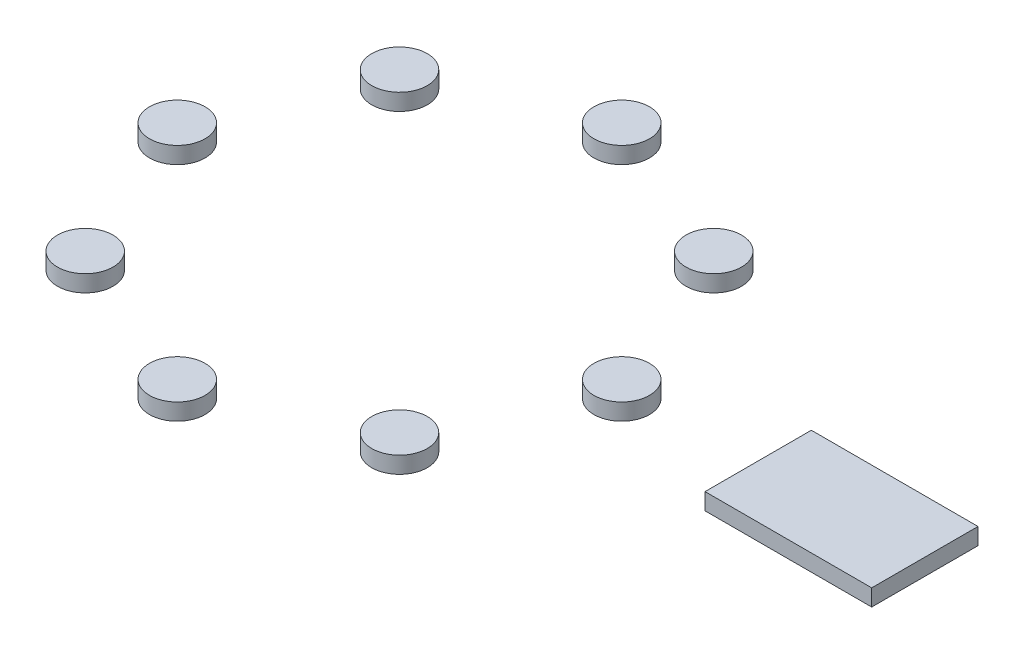
from build123d import *

# Parameters (mm, degrees)
SKETCH1_W             = 15
SKETCH1_H             = 9.566733068
BOSS_EXTRUDE3_DEPTH   = 1.5
SKETCH1_R             = 2.5
BOSS_EXTRUDE3_2_DEPTH = 1.5
BOSS_EXTRUDE3_3_DEPTH = 1.5
BOSS_EXTRUDE3_4_DEPTH = 1.5
BOSS_EXTRUDE3_5_DEPTH = 1.5
BOSS_EXTRUDE3_6_DEPTH = 1.5
BOSS_EXTRUDE3_7_DEPTH = 1.5
BOSS_EXTRUDE3_8_DEPTH = 1.5
BOSS_EXTRUDE3_9_DEPTH = 1.5


with BuildPart() as part:
    # Sketch1 → Boss-Extrude3 (new body)
    with BuildSketch(Plane(origin=(0, 0, 0), x_dir=(1, 0, 0), z_dir=(0, 1, 0))):
        with Locations((25, -0.216633466)):
            Rectangle(SKETCH1_W, SKETCH1_H)
    extrude(amount=BOSS_EXTRUDE3_DEPTH)


with BuildPart() as body_2:
    # Sketch1 → Boss-Extrude3 2 (new body)
    with BuildSketch(Plane(origin=(0, 0, 0), x_dir=(1, 0, 0), z_dir=(0, 1, 0))):
        with Locations((-35, 0)):
            Circle(SKETCH1_R)
    extrude(amount=BOSS_EXTRUDE3_2_DEPTH)


with BuildPart() as body_3:
    # Sketch1 → Boss-Extrude3 3 (new body)
    with BuildSketch(Plane(origin=(0, 0, 0), x_dir=(1, 0, 0), z_dir=(0, 1, 0))):
        with Locations((-29.142135624, 14.142135624)):
            Circle(SKETCH1_R)
    extrude(amount=BOSS_EXTRUDE3_3_DEPTH)


with BuildPart() as body_4:
    # Sketch1 → Boss-Extrude3 4 (new body)
    with BuildSketch(Plane(origin=(0, 0, 0), x_dir=(1, 0, 0), z_dir=(0, 1, 0))):
        with Locations((-15, 20)):
            Circle(SKETCH1_R)
    extrude(amount=BOSS_EXTRUDE3_4_DEPTH)


with BuildPart() as body_5:
    # Sketch1 → Boss-Extrude3 5 (new body)
    with BuildSketch(Plane(origin=(0, 0, 0), x_dir=(1, 0, 0), z_dir=(0, 1, 0))):
        with Locations((-0.857864376, 14.142135624)):
            Circle(SKETCH1_R)
    extrude(amount=BOSS_EXTRUDE3_5_DEPTH)


with BuildPart() as body_6:
    # Sketch1 → Boss-Extrude3 6 (new body)
    with BuildSketch(Plane(origin=(0, 0, 0), x_dir=(1, 0, 0), z_dir=(0, 1, 0))):
        with Locations((5, 0)):
            Circle(SKETCH1_R)
    extrude(amount=BOSS_EXTRUDE3_6_DEPTH)


with BuildPart() as body_7:
    # Sketch1 → Boss-Extrude3 7 (new body)
    with BuildSketch(Plane(origin=(0, 0, 0), x_dir=(1, 0, 0), z_dir=(0, 1, 0))):
        with Locations((-0.857864376, -14.142135624)):
            Circle(SKETCH1_R)
    extrude(amount=BOSS_EXTRUDE3_7_DEPTH)


with BuildPart() as body_8:
    # Sketch1 → Boss-Extrude3 8 (new body)
    with BuildSketch(Plane(origin=(0, 0, 0), x_dir=(1, 0, 0), z_dir=(0, 1, 0))):
        with Locations((-15, -20)):
            Circle(SKETCH1_R)
    extrude(amount=BOSS_EXTRUDE3_8_DEPTH)


with BuildPart() as body_9:
    # Sketch1 → Boss-Extrude3 9 (new body)
    with BuildSketch(Plane(origin=(0, 0, 0), x_dir=(1, 0, 0), z_dir=(0, 1, 0))):
        with Locations((-29.142135624, -14.142135624)):
            Circle(SKETCH1_R)
    extrude(amount=BOSS_EXTRUDE3_9_DEPTH)


solid = Compound([part.part, body_2.part, body_3.part, body_4.part, body_5.part, body_6.part, body_7.part, body_8.part, body_9.part])
